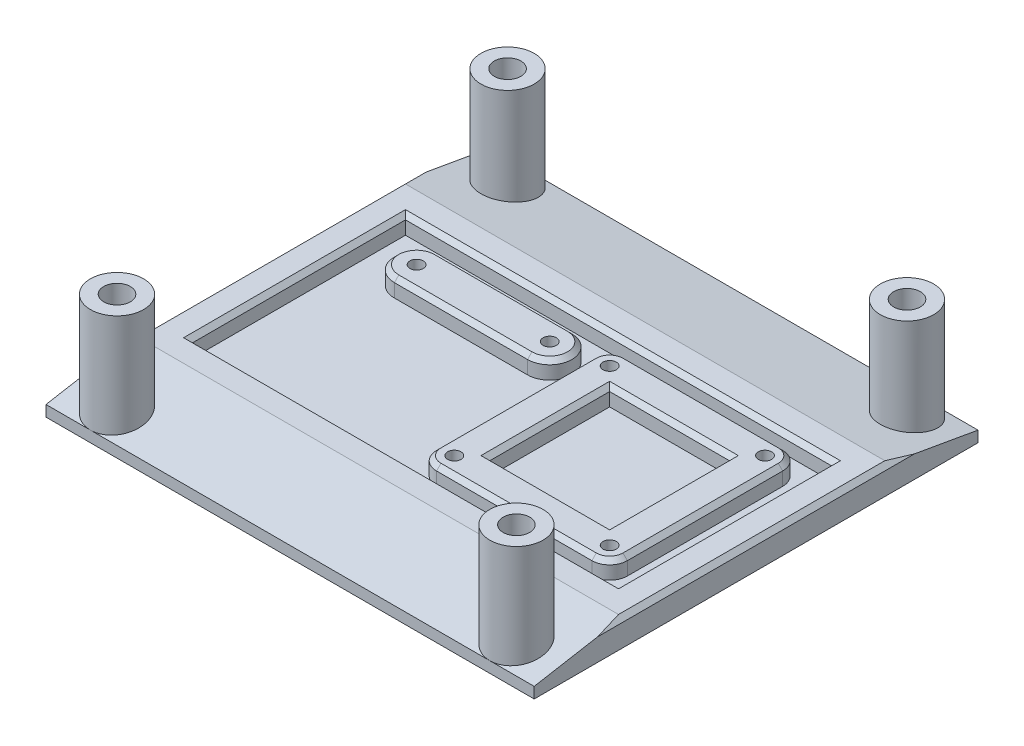
from build123d import *

# Parameters (mm, degrees)
SKETCH_1_W       = 110
SKETCH_1_H       = 100
SKETCH_1_R       = 3
EXTRUDE_1_DEPTH  = 2
SKETCH_2_W       = 110
SKETCH_2_H       = 100
SKETCH_2_R       = 3
SKETCH_2_W_2     = 96
SKETCH_2_H_2     = 48
SKETCH_2_R_2     = 1.5
SKETCH_2_W_3     = 27
SKETCH_2_H_3     = 27
EXTRUDE_2_DEPTH  = 4
CHAMFER_1_SIZE   = 1
SKETCH_3_R       = 6
SKETCH_3_R_2     = 3
EXTRUDE_3_DEPTH  = 20
CHAMFER_2_SIZE   = 1
CHAMFER_3_SIZE   = 20
CHAMFER_3_SIZE_2 = 3.526539614


with BuildPart() as part:
    # Эскиз1 → Бобышка-Вытянуть1 (new body)
    with BuildSketch(Plane(origin=(0, 0, 0), x_dir=(1, 0, 0), z_dir=(0, 1, 0))):
        Rectangle(SKETCH_1_W, SKETCH_1_H)
        with Locations(Location((-45, 44, 0), (0, 0, 270))):
            Circle(SKETCH_1_R, mode=Mode.SUBTRACT)
        with Locations(Location((-45, -44, 0), (0, 0, 270))):
            Circle(SKETCH_1_R, mode=Mode.SUBTRACT)
        with Locations(Location((45, -44, 0), (0, 0, 270))):
            Circle(SKETCH_1_R, mode=Mode.SUBTRACT)
        with Locations(Location((45, 44, 0), (0, 0, 270))):
            Circle(SKETCH_1_R, mode=Mode.SUBTRACT)
    extrude(amount=EXTRUDE_1_DEPTH)

    # Эскиз2 → Бобышка-Вытянуть2 (add)
    # profile 1 of 3: a face of its own
    with BuildSketch(Plane(origin=(0, 2, 0), x_dir=(1, 0, 0), z_dir=(0, 1, 0))):
        Rectangle(SKETCH_2_W, SKETCH_2_H)
        with Locations(Location((-45, 44, 0), (0, 0, 270))):
            Circle(SKETCH_2_R, mode=Mode.SUBTRACT)
        with Locations(Location((45, 44, 0), (0, 0, 270))):
            Circle(SKETCH_2_R, mode=Mode.SUBTRACT)
        with Locations(Location((45, -44, 0), (0, 0, 270))):
            Circle(SKETCH_2_R, mode=Mode.SUBTRACT)
        with Locations(Location((-45, -44, 0), (0, 0, 270))):
            Circle(SKETCH_2_R, mode=Mode.SUBTRACT)
        Rectangle(SKETCH_2_W_2, SKETCH_2_H_2, mode=Mode.SUBTRACT)
    # profile 2 of 3: a face of its own
    with BuildSketch(Plane(origin=(0, 2, 0), x_dir=(1, 0, 0), z_dir=(0, 1, 0))):
        with BuildLine():
            Line((-7, 20.5), (-37, 20.5))
            ThreePointArc((-37, 20.5), (-42, 15.5), (-37, 10.5))
            Line((-37, 10.5), (-7, 10.5))
            ThreePointArc((-7, 10.5), (-2, 15.5), (-7, 20.5))
        make_face()
        with Locations(Location((-37, 15.5, 0), (0, 0, 270))):
            Circle(SKETCH_2_R_2, mode=Mode.SUBTRACT)
        with Locations(Location((-7, 15.5, 0), (0, 0, 270))):
            Circle(SKETCH_2_R_2, mode=Mode.SUBTRACT)
    # profile 3 of 3: a face of its own
    with BuildSketch(Plane(origin=(0, 2, 0), x_dir=(1, 0, 0), z_dir=(0, 1, 0))):
        with BuildLine():
            Line((0.5, 17.5), (0.5, -17.5))
            ThreePointArc((0.5, -17.5), (1.671572875, -20.328427125), (4.5, -21.5))
            Line((4.5, -21.5), (39.5, -21.5))
            ThreePointArc((39.5, -21.5), (42.328427125, -20.328427125), (43.5, -17.5))
            Line((43.5, -17.5), (43.5, 17.5))
            ThreePointArc((43.5, 17.5), (42.328427125, 20.328427125), (39.5, 21.5))
            Line((39.5, 21.5), (4.5, 21.5))
            ThreePointArc((4.5, 21.5), (1.671572875, 20.328427125), (0.5, 17.5))
        make_face()
        with Locations(Location((4.5, 17.5, 0), (0, 0, 270))):
            Circle(SKETCH_2_R_2, mode=Mode.SUBTRACT)
        with Locations(Location((39.5, 17.5, 0), (0, 0, 270))):
            Circle(SKETCH_2_R_2, mode=Mode.SUBTRACT)
        with Locations(Location((39.5, -17.5, 0), (0, 0, 270))):
            Circle(SKETCH_2_R_2, mode=Mode.SUBTRACT)
        with Locations(Location((4.5, -17.5, 0), (0, 0, 270))):
            Circle(SKETCH_2_R_2, mode=Mode.SUBTRACT)
        with Locations((22, 0)):
            Rectangle(SKETCH_2_W_3, SKETCH_2_H_3, mode=Mode.SUBTRACT)
    extrude(amount=EXTRUDE_2_DEPTH)

    # Фаска1
    chamfer_1_edges = [part.edges().sort_by_distance(p)[0] for p in [
        (0, 6, -24),
        (48, 6, 0),
        (0, 6, 24),
        (-48, 6, 0),
        (-2, 6, -15.5),
        (-22, 6, -20.5),
        (-42, 6, -15.5),
        (-22, 6, -10.5),
        (22, 6, 13.5),
        (8.5, 6, 0),
        (1.671572875, 6, 20.328427125),
        (42.328427125, 6, 20.328427125),
        (43.5, 6, 0),
        (42.328427125, 6, -20.328427125),
        (22, 6, -21.5),
        (1.671572875, 6, -20.328427125),
        (22, 6, 21.5),
        (0.5, 6, 0),
        (22, 6, -13.5),
        (35.5, 6, 0),
    ]]
    chamfer(chamfer_1_edges, length=CHAMFER_1_SIZE)

    # Эскиз3 → Бобышка-Вытянуть3 (add)
    # profile 1 of 4: a face of its own
    with BuildSketch(Plane(origin=(0, 6, 0), x_dir=(1, 0, 0), z_dir=(0, 1, 0))):
        with Locations(Location((-45, -44, 0), (0, 0, 270))):
            Circle(SKETCH_3_R)
        with Locations(Location((-45, -44, 0), (0, 0, 270))):
            Circle(SKETCH_3_R_2, mode=Mode.SUBTRACT)
    # profile 2 of 4: a face of its own
    with BuildSketch(Plane(origin=(0, 6, 0), x_dir=(1, 0, 0), z_dir=(0, 1, 0))):
        with Locations(Location((45, -44, 0), (0, 0, 270))):
            Circle(SKETCH_3_R)
        with Locations(Location((45, -44, 0), (0, 0, 270))):
            Circle(SKETCH_3_R_2, mode=Mode.SUBTRACT)
    # profile 3 of 4: a face of its own
    with BuildSketch(Plane(origin=(0, 6, 0), x_dir=(1, 0, 0), z_dir=(0, 1, 0))):
        with Locations(Location((45, 44, 0), (0, 0, 90))):
            Circle(SKETCH_3_R)
        with Locations(Location((45, 44, 0), (0, 0, 270))):
            Circle(SKETCH_3_R_2, mode=Mode.SUBTRACT)
    # profile 4 of 4: a face of its own
    with BuildSketch(Plane(origin=(0, 6, 0), x_dir=(1, 0, 0), z_dir=(0, 1, 0))):
        with Locations(Location((-45, 44, 0), (0, 0, 90))):
            Circle(SKETCH_3_R)
        with Locations(Location((-45, 44, 0), (0, 0, 270))):
            Circle(SKETCH_3_R_2, mode=Mode.SUBTRACT)
    extrude(amount=EXTRUDE_3_DEPTH)

    # Фаска2
    chamfer_2_edges = [part.edges().sort_by_distance(p)[0] for p in [
        (55, 6, 0),
        (-55, 6, 0),
    ]]
    chamfer(chamfer_2_edges, length=CHAMFER_2_SIZE)

    # Фаска3
    # the kernel refuses this chamfer: 20, 3.526539614 mm, written as the material it takes off along each edge
    with BuildSketch(Plane(origin=(-105.970775928, 6, -50), x_dir=(0, 0.006682531656101757, 0.9999776716360547), z_dir=(1, 0, 0))) as chamfer_3_piece_1_section:
        Polygon((CHAMFER_3_SIZE * 0.999977671636, CHAMFER_3_SIZE * 0.0066825316561), (-CHAMFER_3_SIZE_2 * 0.00668253165642, CHAMFER_3_SIZE_2 * 0.999977671684), (0, 0), align=None)
    chamfer_3_piece_1 = extrude(amount=60.970775928, mode=Mode.PRIVATE)
    chamfer_3_piece_1 = chamfer_3_piece_1 - Plane(origin=(-45, 4.865335076, -44), x_dir=(0, 0, -1), z_dir=(0, -1, 0)) * Cylinder(6, 202, mode=Mode.PRIVATE)
    add(chamfer_3_piece_1, mode=Mode.SUBTRACT)
    with BuildSketch(Plane(origin=(105.970775928, 6, 50), x_dir=(0, 0.006682531656101757, -0.9999776716360547), z_dir=(-1, 0, 0))) as chamfer_3_piece_2_section:
        Polygon((CHAMFER_3_SIZE * 0.999977671636, CHAMFER_3_SIZE * 0.0066825316561), (-CHAMFER_3_SIZE_2 * 0.00668253165642, CHAMFER_3_SIZE_2 * 0.999977671684), (0, 0), align=None)
    chamfer_3_piece_2 = extrude(amount=60.970775928, mode=Mode.PRIVATE)
    chamfer_3_piece_2 = chamfer_3_piece_2 - Plane(origin=(45, 4.865335076, 44), x_dir=(0, 0, 1), z_dir=(0, -1, 0)) * Cylinder(6, 202, mode=Mode.PRIVATE)
    add(chamfer_3_piece_2, mode=Mode.SUBTRACT)
    with BuildSketch(Plane(origin=(45, 6, 50), x_dir=(0, 0.006682531656101757, -0.9999776716360547), z_dir=(-1, 0, 0))) as chamfer_3_piece_3_section:
        Polygon((CHAMFER_3_SIZE * 0.999977671636, CHAMFER_3_SIZE * 0.0066825316561), (-CHAMFER_3_SIZE_2 * 0.00668253165642, CHAMFER_3_SIZE_2 * 0.999977671684), (0, 0), align=None)
    chamfer_3_piece_3 = extrude(amount=90, mode=Mode.PRIVATE)
    chamfer_3_piece_3 = chamfer_3_piece_3 - Plane(origin=(45, 4.835622005, 44), x_dir=(0, 0, 1), z_dir=(0, -1, 0)) * Cylinder(6, 260, mode=Mode.PRIVATE)
    chamfer_3_piece_3 = chamfer_3_piece_3 - Plane(origin=(-45, 4.835622005, 44), x_dir=(0, 0, 1), z_dir=(0, -1, 0)) * Cylinder(6, 260, mode=Mode.PRIVATE)
    add(chamfer_3_piece_3, mode=Mode.SUBTRACT)
    with BuildSketch(Plane(origin=(-45, 6, 50), x_dir=(0, 0.006682531656101757, -0.9999776716360547), z_dir=(-1, 0, 0))) as chamfer_3_piece_4_section:
        Polygon((CHAMFER_3_SIZE * 0.999977671636, CHAMFER_3_SIZE * 0.0066825316561), (-CHAMFER_3_SIZE_2 * 0.00668253165642, CHAMFER_3_SIZE_2 * 0.999977671684), (0, 0), align=None)
    chamfer_3_piece_4 = extrude(amount=60.970775928, mode=Mode.PRIVATE)
    chamfer_3_piece_4 = chamfer_3_piece_4 - Plane(origin=(-45, 4.865335076, 44), x_dir=(0, 0, 1), z_dir=(0, -1, 0)) * Cylinder(6, 202, mode=Mode.PRIVATE)
    add(chamfer_3_piece_4, mode=Mode.SUBTRACT)
    with BuildSketch(Plane(origin=(45, 6, -50), x_dir=(0, 0.006682531656101757, 0.9999776716360547), z_dir=(1, 0, 0))) as chamfer_3_piece_5_section:
        Polygon((CHAMFER_3_SIZE * 0.999977671636, CHAMFER_3_SIZE * 0.0066825316561), (-CHAMFER_3_SIZE_2 * 0.00668253165642, CHAMFER_3_SIZE_2 * 0.999977671684), (0, 0), align=None)
    chamfer_3_piece_5 = extrude(amount=60.970775928, mode=Mode.PRIVATE)
    chamfer_3_piece_5 = chamfer_3_piece_5 - Plane(origin=(45, 4.865335076, -44), x_dir=(0, 0, -1), z_dir=(0, -1, 0)) * Cylinder(6, 202, mode=Mode.PRIVATE)
    add(chamfer_3_piece_5, mode=Mode.SUBTRACT)
    with BuildSketch(Plane(origin=(-45, 6, -50), x_dir=(0, 0.006682531656101757, 0.9999776716360547), z_dir=(1, 0, 0))) as chamfer_3_piece_6_section:
        Polygon((CHAMFER_3_SIZE * 0.999977671636, CHAMFER_3_SIZE * 0.0066825316561), (-CHAMFER_3_SIZE_2 * 0.00668253165642, CHAMFER_3_SIZE_2 * 0.999977671684), (0, 0), align=None)
    chamfer_3_piece_6 = extrude(amount=90, mode=Mode.PRIVATE)
    chamfer_3_piece_6 = chamfer_3_piece_6 - Plane(origin=(45, 4.835622005, -44), x_dir=(0, 0, -1), z_dir=(0, -1, 0)) * Cylinder(6, 260, mode=Mode.PRIVATE)
    chamfer_3_piece_6 = chamfer_3_piece_6 - Plane(origin=(-45, 4.835622005, -44), x_dir=(0, 0, -1), z_dir=(0, -1, 0)) * Cylinder(6, 260, mode=Mode.PRIVATE)
    add(chamfer_3_piece_6, mode=Mode.SUBTRACT)


solid = part.part
